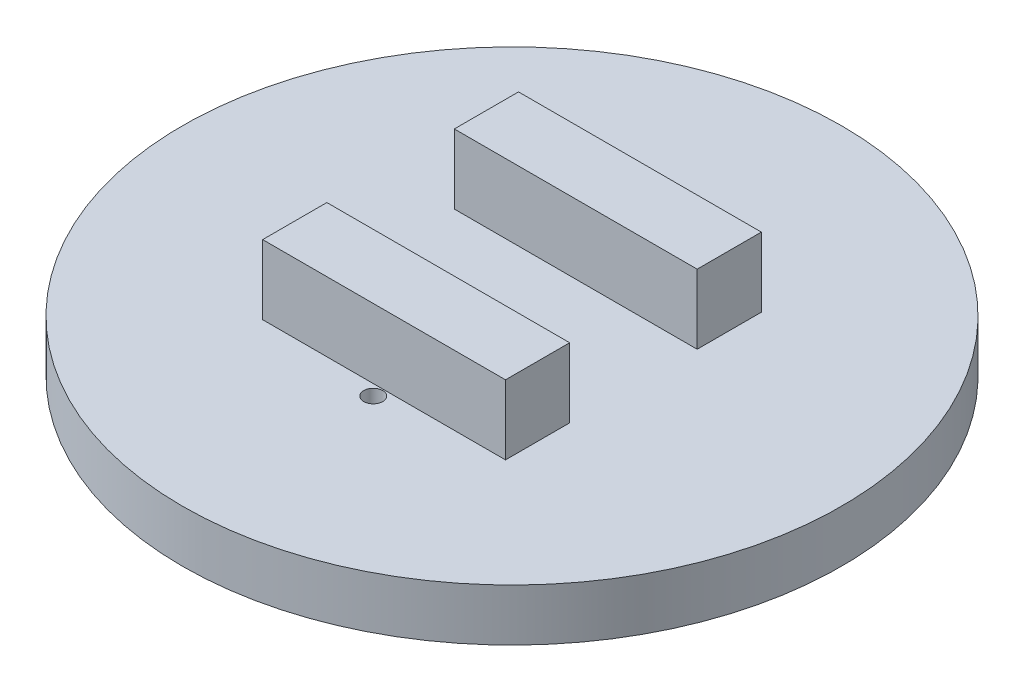
from build123d import *

# Parameters (mm, degrees)
SKETCH1_R           = 95
BOSS_EXTRUDE1_DEPTH = 15
SKETCH4_R           = 2.75
CUT_EXTRUDE1_DEPTH  = 5
SKETCH8_W           = 70
SKETCH8_H           = 18.5
BOSS_EXTRUDE3_DEPTH = 20


with BuildPart() as part:
    # Sketch1 → Boss-Extrude1 (new body)
    with BuildSketch(Plane(origin=(0, 0, 0), x_dir=(1, 0, 0), z_dir=(0, 1, 0))):
        Circle(SKETCH1_R)
    extrude(amount=BOSS_EXTRUDE1_DEPTH)

    # Sketch4 → Cut-Extrude1 (cut)
    with BuildSketch(Plane(origin=(0, 15, 0), x_dir=(1, 0, 0), z_dir=(0, 1, 0))):
        with Locations((0, 40)):
            Circle(SKETCH4_R)
        with Locations((0, -40)):
            Circle(SKETCH4_R)
    extrude(amount=-CUT_EXTRUDE1_DEPTH, mode=Mode.SUBTRACT)

    # Sketch8 → Boss-Extrude3 (add)
    with BuildSketch(Plane(origin=(0, 15, 0), x_dir=(1, 0, 0), z_dir=(0, 1, 0))):
        with Locations((0, 27.625)):
            Rectangle(SKETCH8_W, SKETCH8_H)
        with Locations((0, -27.625)):
            Rectangle(SKETCH8_W, SKETCH8_H)
    extrude(amount=BOSS_EXTRUDE3_DEPTH)


solid = part.part
